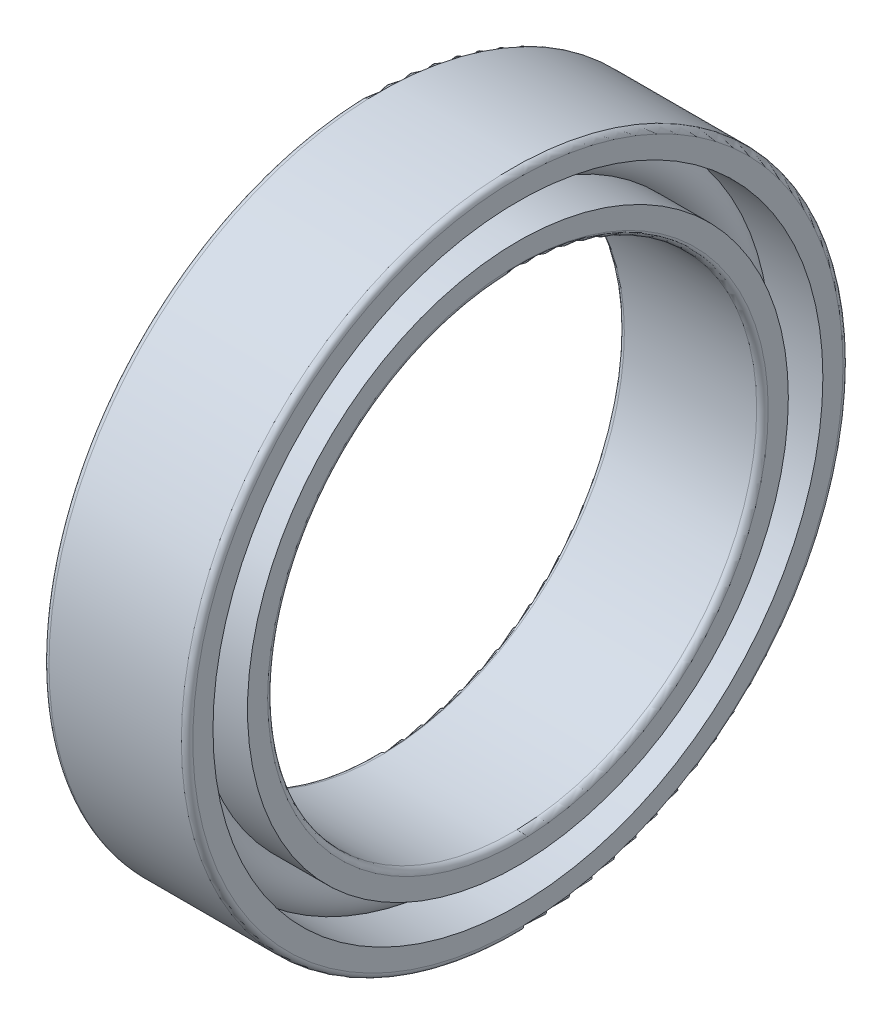
from build123d import *

# Parameters (mm, degrees)
CAGSPISKE_W     = 0.18
CAGSPISKE_H     = 0.3
CAGESPINE_ANGLE = 0.001
BALSIMSKE_R     = 0.9


with BuildPart() as part:
    # CagSpiSke → CageSpine (revolve)
    with BuildSketch(Plane.XY):
        with Locations((0, 10)):
            Rectangle(CAGSPISKE_W, CAGSPISKE_H)
    revolve(axis=Axis((-20.6375, 0, 0), (-1, 0, 0)), revolution_arc=CAGESPINE_ANGLE)

    # BalSimSke → BallsSimplified (revolve)
    with BuildSketch(Plane.XY):
        with Locations((0, 10)):
            Circle(BALSIMSKE_R)
    revolve(axis=Axis((-10, 0, 0), (1, 0, 0)))

    # InnRacSke → InnerRace (revolve)
    with BuildSketch(Plane.XY):
        with BuildLine():
            Line((-0.63688696, 9.4), (-2.5, 9.4))
            Line((-2.5, 9.4), (-2.5, 8.7))
            ThreePointArc((-2.5, 8.7), (-2.441421356, 8.558578644), (-2.3, 8.5))
            Line((-2.3, 8.5), (2.3, 8.5))
            ThreePointArc((2.3, 8.5), (2.441421356, 8.558578644), (2.5, 8.7))
            Line((2.5, 8.7), (2.5, 9.4))
            Line((2.5, 9.4), (0.63688696, 9.4))
            ThreePointArc((0.63688696, 9.4), (0, 9.125), (-0.63688696, 9.4))
        make_face()
    revolve(axis=Axis((-20.6375, 0, 0), (1, 0, 0)))

    # OutRacSke → OuterRace (revolve)
    with BuildSketch(Plane.XY):
        with BuildLine():
            Line((-0.63688696, 10.6), (-2.5, 10.6))
            Line((-2.5, 10.6), (-2.5, 11.3))
            ThreePointArc((-2.5, 11.3), (-2.441421356, 11.441421356), (-2.3, 11.5))
            Line((-2.3, 11.5), (2.3, 11.5))
            ThreePointArc((2.3, 11.5), (2.441421356, 11.441421356), (2.5, 11.3))
            Line((2.5, 11.3), (2.5, 10.6))
            Line((2.5, 10.6), (0.63688696, 10.6))
            ThreePointArc((0.63688696, 10.6), (0, 10.875), (-0.63688696, 10.6))
        make_face()
    revolve(axis=Axis((-20.6375, 0, 0), (1, 0, 0)))


solid = part.part
